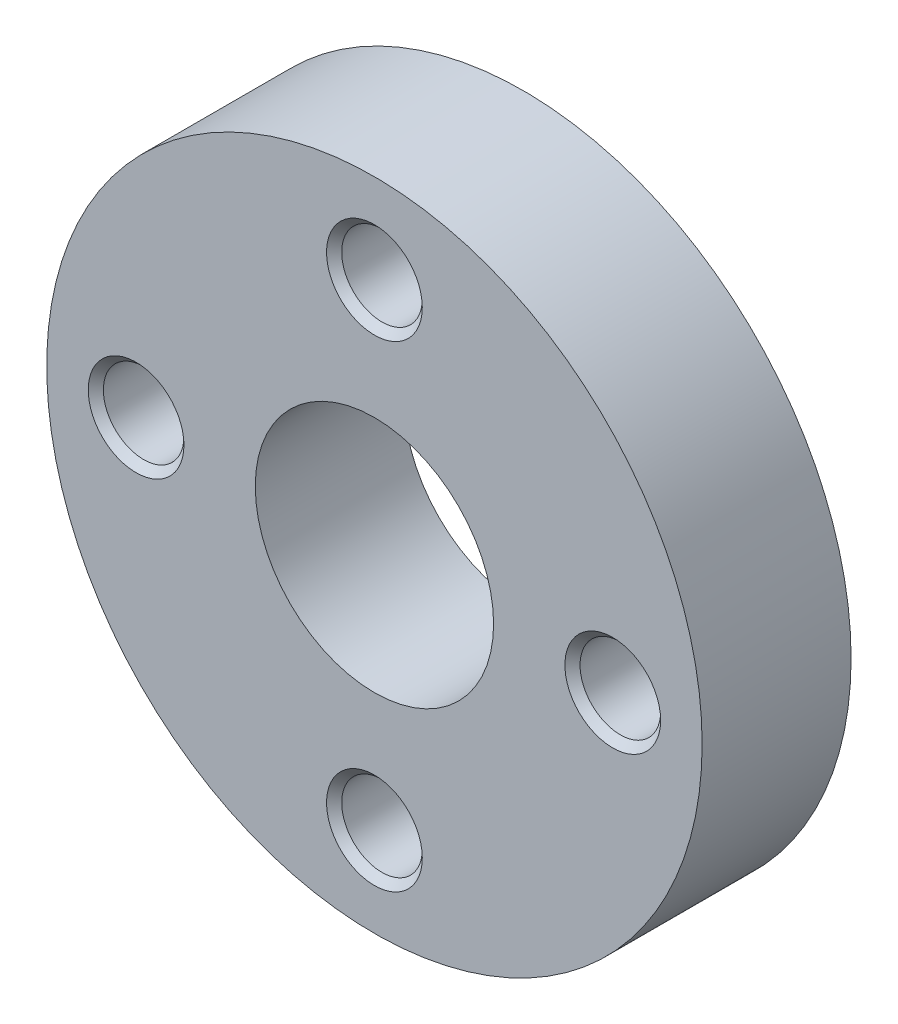
from build123d import *

# Parameters (mm, degrees)
SKETCH1_R             = 11
EXTRUDE1_DEPTH        = 5
F_6_32_TAPPED_HOLE3_D = 2.7051
CHAMFER1_SIZE         = 0.254
SKETCH2_R             = 4
EXTRUDE2_DEPTH        = 17.340134638


with BuildPart() as part:
    # Sketch1 → Extrude1 (new body)
    with BuildSketch(Plane.XY):
        Circle(SKETCH1_R)
    extrude(amount=-EXTRUDE1_DEPTH)

    # #6-32 Tapped Hole3 (through all)
    with Locations(Plane(origin=(0, 8, 0), x_dir=(1, 0, 0), z_dir=(0, 0, 1))):
        with Locations((0, 0), (-8, -8), (8, -8), (0, -16)):
            Hole(F_6_32_TAPPED_HOLE3_D / 2)

    # Chamfer1
    chamfer1_edges = [part.edges().sort_by_distance(p)[0] for p in [
        (1.35255, 8, 0),
        (1.35255, -8, -5),
        (-6.64745, 0, -5),
        (1.35255, 8, -5),
        (9.35255, 0, -5),
        (9.35255, 0, 0),
        (1.35255, -8, 0),
        (-6.64745, 0, 0),
    ]]
    chamfer(chamfer1_edges, length=CHAMFER1_SIZE)

    # Sketch2 → Extrude2 (cut, through all)
    with BuildSketch(Plane.XY):
        Circle(SKETCH2_R)
    extrude(amount=-EXTRUDE2_DEPTH, mode=Mode.SUBTRACT)


solid = part.part
